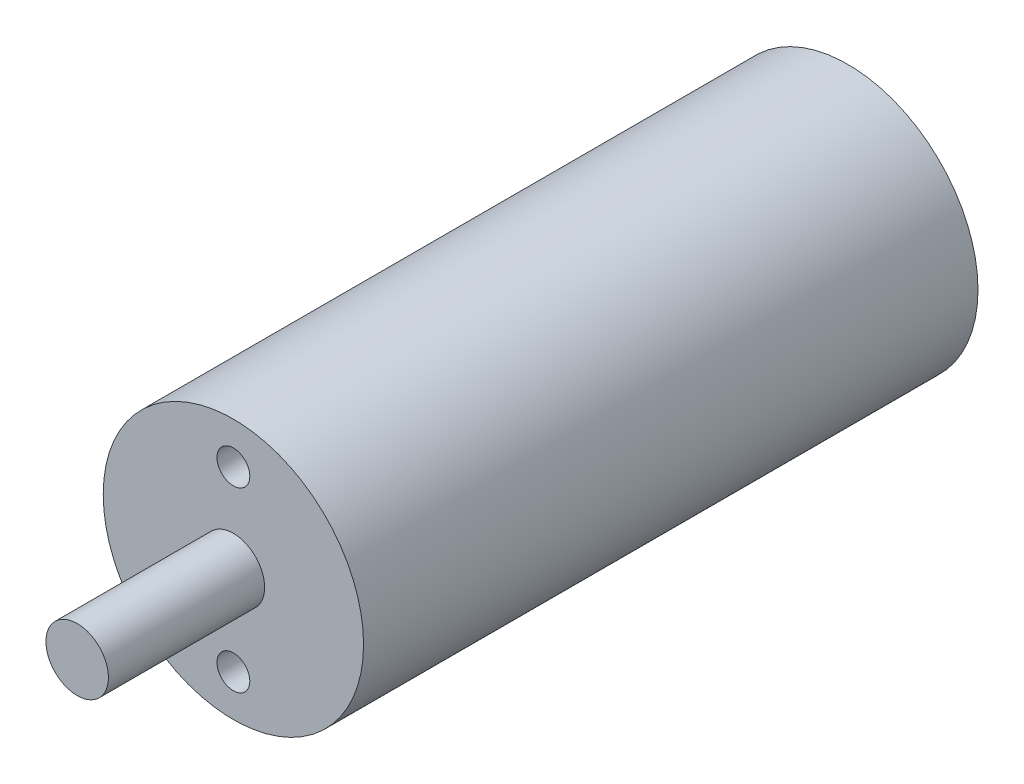
from build123d import *

# Parameters (mm, degrees)
SKETCH1_R           = 12.5
BOSS_EXTRUDE1_DEPTH = 59
SKETCH2_R           = 1.575
CUT_EXTRUDE1_DEPTH  = 12.7
SKETCH3_R           = 3
BOSS_EXTRUDE2_DEPTH = 15


with BuildPart() as part:
    # Sketch1 → Boss-Extrude1 (new body)
    with BuildSketch(Plane.XY):
        with Locations((-10.391437804, 5.875911401)):
            Circle(SKETCH1_R)
    extrude(amount=BOSS_EXTRUDE1_DEPTH)

    # Sketch2 → Cut-Extrude1 (cut)
    with BuildSketch(Plane.XY.offset(59)):
        with Locations((-10.391437804, 14.397611401)):
            Circle(SKETCH2_R)
        with Locations((-10.391437804, -2.645788599)):
            Circle(SKETCH2_R)
    extrude(amount=-CUT_EXTRUDE1_DEPTH, mode=Mode.SUBTRACT)

    # Sketch3 → Boss-Extrude2 (add)
    with BuildSketch(Plane.XY.offset(59)):
        with Locations((-10.391437804, 5.875911401)):
            Circle(SKETCH3_R)
    extrude(amount=BOSS_EXTRUDE2_DEPTH)


solid = part.part
